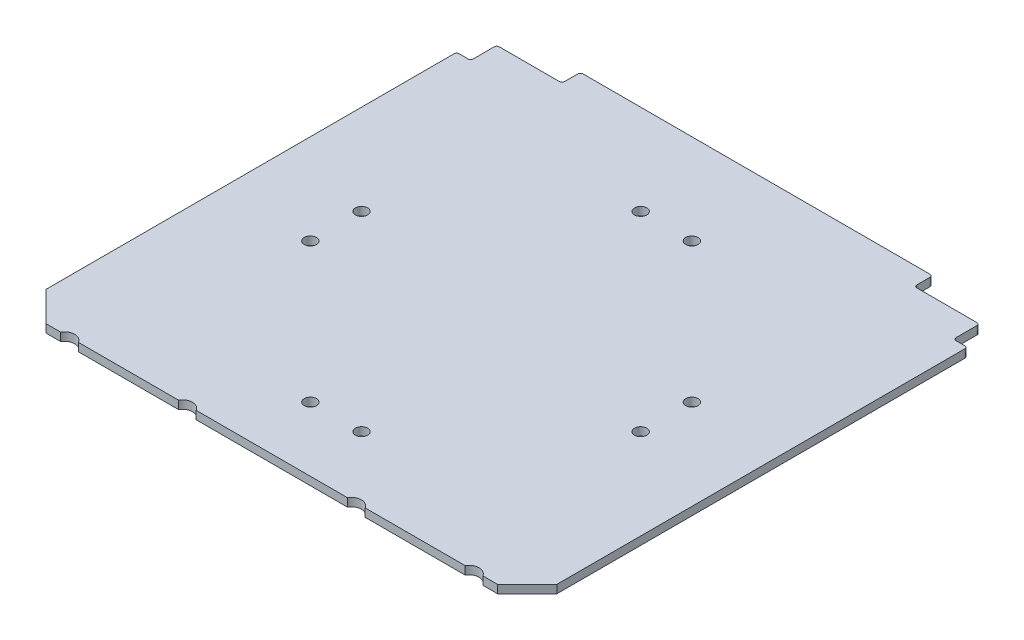
from build123d import *

# Parameters (mm, degrees)
GENERICCARDPCBDEFINITION_START = -0.8
GENERICCARDPCBDEFINITION_DEPTH = 1.6
CUT_EXTRUDE1_REACH             = 72.587
SKETCH1_R                      = 1.2


# Read off the part's stored shape, not the designer's step: GenericCardPCBDefinition
with BuildPart() as part:
    # GenericCardPCBDefinition outline → GenericCardPCBDefinition (new body)
    with BuildSketch(Plane(origin=(0, 0, 0), x_dir=(1, 0, 0), z_dir=(0, 1, 0)).offset(GENERICCARDPCBDEFINITION_START)):
        with BuildLine():
            Line((-49.9, -39), (-44.1, -44.8))
            Line((-44.1, -44.8), (-41.232050808, -44.8))
            ThreePointArc((-41.232050808, -44.8), (-39.5, -43.8), (-37.767949192, -44.8))
            Line((-37.767949192, -44.8), (-18.232050808, -44.8))
            ThreePointArc((-18.232050808, -44.8), (-16.5, -43.8), (-14.767949192, -44.8))
            Line((-14.767949192, -44.8), (14.767949192, -44.8))
            ThreePointArc((14.767949192, -44.8), (16.5, -43.8), (18.232050808, -44.8))
            Line((18.232050808, -44.8), (37.767949192, -44.8))
            ThreePointArc((37.767949192, -44.8), (39.5, -43.8), (41.232050808, -44.8))
            Line((41.232050808, -44.8), (44.1, -44.8))
            Line((44.1, -44.8), (49.9, -39))
            Line((49.9, -39), (49.9, 40.7))
            ThreePointArc((49.9, 40.7), (49.753553391, 41.053553391), (49.4, 41.2))
            Line((49.4, 41.2), (47.65, 41.2))
            ThreePointArc((47.65, 41.2), (47.296446609, 41.346446609), (47.15, 41.7))
            Line((47.15, 41.7), (47.15, 45.8))
            ThreePointArc((47.15, 45.8), (47.003553391, 46.153553391), (46.65, 46.3))
            Line((46.65, 46.3), (34.9, 46.3))
            ThreePointArc((34.9, 46.3), (34.546446609, 46.446446609), (34.4, 46.8))
            Line((34.4, 46.8), (34.4, 49.4))
            ThreePointArc((34.4, 49.4), (34.253553391, 49.753553391), (33.9, 49.9))
            Line((33.9, 49.9), (-33.9, 49.9))
            ThreePointArc((-33.9, 49.9), (-34.253553391, 49.753553391), (-34.4, 49.4))
            Line((-34.4, 49.4), (-34.4, 46.8))
            ThreePointArc((-34.4, 46.8), (-34.546446609, 46.446446609), (-34.9, 46.3))
            Line((-34.9, 46.3), (-46.65, 46.3))
            ThreePointArc((-46.65, 46.3), (-47.003553391, 46.153553391), (-47.15, 45.8))
            Line((-47.15, 45.8), (-47.15, 41.7))
            ThreePointArc((-47.15, 41.7), (-47.296446609, 41.346446609), (-47.65, 41.2))
            Line((-47.65, 41.2), (-49.4, 41.2))
            ThreePointArc((-49.4, 41.2), (-49.753553391, 41.053553391), (-49.9, 40.7))
            Line((-49.9, 40.7), (-49.9, -39))
        make_face()
    extrude(amount=GENERICCARDPCBDEFINITION_DEPTH)

    # Sketch1 → Cut-Extrude1 (cut, up to next)
    with BuildSketch(Plane(origin=(0, 0.8, 0), x_dir=(1, 0, 0), z_dir=(0, 1, 0)), mode=Mode.PRIVATE) as cut_extrude1_sk1:
        with Locations(Location((32.26, 5, 0), (0, 0, 270))):
            Circle(SKETCH1_R)
    cut_extrude1_tool1 = extrude(cut_extrude1_sk1.sketch, amount=-CUT_EXTRUDE1_REACH, mode=Mode.PRIVATE) & part.part
    # Sketch1 → Cut-Extrude1 (cut, up to next)
    with BuildSketch(Plane(origin=(0, 0.8, 0), x_dir=(1, 0, 0), z_dir=(0, 1, 0)), mode=Mode.PRIVATE) as cut_extrude1_sk2:
        with Locations(Location((32.26, -5, 0), (0, 0, 270))):
            Circle(SKETCH1_R)
    cut_extrude1_tool2 = extrude(cut_extrude1_sk2.sketch, amount=-CUT_EXTRUDE1_REACH, mode=Mode.PRIVATE) & part.part
    # Sketch1 → Cut-Extrude1 (cut, up to next)
    with BuildSketch(Plane(origin=(0, 0.8, 0), x_dir=(1, 0, 0), z_dir=(0, 1, 0)), mode=Mode.PRIVATE) as cut_extrude1_sk3:
        with Locations(Location((-32.26, 5, 0), (0, 0, 270))):
            Circle(SKETCH1_R)
    cut_extrude1_tool3 = extrude(cut_extrude1_sk3.sketch, amount=-CUT_EXTRUDE1_REACH, mode=Mode.PRIVATE) & part.part
    # Sketch1 → Cut-Extrude1 (cut, up to next)
    with BuildSketch(Plane(origin=(0, 0.8, 0), x_dir=(1, 0, 0), z_dir=(0, 1, 0)), mode=Mode.PRIVATE) as cut_extrude1_sk4:
        with Locations(Location((-32.26, -5, 0), (0, 0, 270))):
            Circle(SKETCH1_R)
    cut_extrude1_tool4 = extrude(cut_extrude1_sk4.sketch, amount=-CUT_EXTRUDE1_REACH, mode=Mode.PRIVATE) & part.part
    # Sketch1 → Cut-Extrude1 (cut, up to next)
    with BuildSketch(Plane(origin=(0, 0.8, 0), x_dir=(1, 0, 0), z_dir=(0, 1, 0)), mode=Mode.PRIVATE) as cut_extrude1_sk5:
        with Locations(Location((-5, -32.26, 0), (0, 0, 270))):
            Circle(SKETCH1_R)
    cut_extrude1_tool5 = extrude(cut_extrude1_sk5.sketch, amount=-CUT_EXTRUDE1_REACH, mode=Mode.PRIVATE) & part.part
    # Sketch1 → Cut-Extrude1 (cut, up to next)
    with BuildSketch(Plane(origin=(0, 0.8, 0), x_dir=(1, 0, 0), z_dir=(0, 1, 0)), mode=Mode.PRIVATE) as cut_extrude1_sk6:
        with Locations(Location((5, -32.26, 0), (0, 0, 270))):
            Circle(SKETCH1_R)
    cut_extrude1_tool6 = extrude(cut_extrude1_sk6.sketch, amount=-CUT_EXTRUDE1_REACH, mode=Mode.PRIVATE) & part.part
    # Sketch1 → Cut-Extrude1 (cut, up to next)
    with BuildSketch(Plane(origin=(0, 0.8, 0), x_dir=(1, 0, 0), z_dir=(0, 1, 0)), mode=Mode.PRIVATE) as cut_extrude1_sk7:
        with Locations(Location((-5, 32.26, 0), (0, 0, 270))):
            Circle(SKETCH1_R)
    cut_extrude1_tool7 = extrude(cut_extrude1_sk7.sketch, amount=-CUT_EXTRUDE1_REACH, mode=Mode.PRIVATE) & part.part
    # Sketch1 → Cut-Extrude1 (cut, up to next)
    with BuildSketch(Plane(origin=(0, 0.8, 0), x_dir=(1, 0, 0), z_dir=(0, 1, 0)), mode=Mode.PRIVATE) as cut_extrude1_sk8:
        with Locations(Location((5, 32.26, 0), (0, 0, 270))):
            Circle(SKETCH1_R)
    cut_extrude1_tool8 = extrude(cut_extrude1_sk8.sketch, amount=-CUT_EXTRUDE1_REACH, mode=Mode.PRIVATE) & part.part
    add(cut_extrude1_tool1.solids().sort_by_distance((32.26, 0.8, -5))[0], mode=Mode.SUBTRACT)
    add(cut_extrude1_tool2.solids().sort_by_distance((32.26, 0.8, 5))[0], mode=Mode.SUBTRACT)
    add(cut_extrude1_tool3.solids().sort_by_distance((-32.26, 0.8, -5))[0], mode=Mode.SUBTRACT)
    add(cut_extrude1_tool4.solids().sort_by_distance((-32.26, 0.8, 5))[0], mode=Mode.SUBTRACT)
    add(cut_extrude1_tool5.solids().sort_by_distance((-5, 0.8, 32.26))[0], mode=Mode.SUBTRACT)
    add(cut_extrude1_tool6.solids().sort_by_distance((5, 0.8, 32.26))[0], mode=Mode.SUBTRACT)
    add(cut_extrude1_tool7.solids().sort_by_distance((-5, 0.8, -32.26))[0], mode=Mode.SUBTRACT)
    add(cut_extrude1_tool8.solids().sort_by_distance((5, 0.8, -32.26))[0], mode=Mode.SUBTRACT)


solid = part.part
